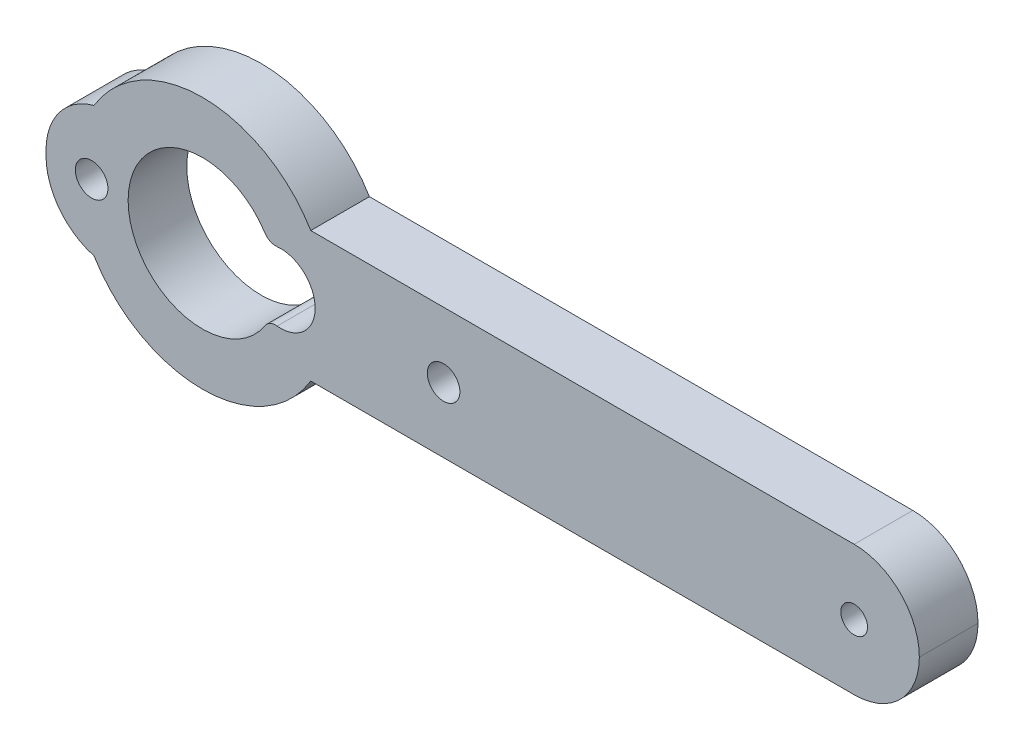
from build123d import *

# Parameters (mm, degrees)
SKETCH_1_R      = 1.025
SKETCH_1_R_2    = 1.25
EXTRUDE_1_DEPTH = 4.5
FILLET_1_R      = 1
FILLET_2_R      = 5
FILLET_3_R      = 5


# Some blends are built 0.0001 mm under size
with BuildPart() as part:
    # 草图1 → 凸台-拉伸1 (new body)
    with BuildSketch(Plane.XY):
        with BuildLine():
            Line((-63.312039461, 0), (-67, 0))
            Line((-67, 0), (-67, -10))
            Line((-67, -10), (-63.312039461, -10))
            ThreePointArc((-63.312039461, -10), (-55, -14.7), (-46.687960539, -10))
            Line((-46.687960539, -10), (0, -10))
            Line((0, -10), (0, 0))
            Line((0, 0), (-46.687960539, 0))
            ThreePointArc((-46.687960539, 0), (-55, 4.7), (-63.312039461, 0))
        make_face()
        with Locations((-5, -5)):
            Circle(SKETCH_1_R, mode=Mode.SUBTRACT)
        with Locations((-63.5, -5)):
            Circle(SKETCH_1_R_2, mode=Mode.SUBTRACT)
        with Locations((-36.5, -5)):
            Circle(SKETCH_1_R_2, mode=Mode.SUBTRACT)
        with BuildLine():
            ThreePointArc((-49.877708333, -2.49957442), (-60.7, -5), (-49.877708333, -7.50042558))
            ThreePointArc((-49.877708333, -7.50042558), (-46.35, -5), (-49.877708333, -2.49957442))
        make_face(mode=Mode.SUBTRACT)
    extrude(amount=EXTRUDE_1_DEPTH)

    # 圆角1
    fillet_1_edges = [part.edges().sort_by_distance(p)[0] for p in [
        (-49.877708333, -7.50042558, 2.25),
        (-49.877708333, -2.49957442, 2.25),
    ]]
    fillet(fillet_1_edges, radius=FILLET_1_R)

    # 圆角2
    fillet_2_edges = [part.edges().sort_by_distance(p)[0] for p in [
        (0, -10, 2.25),
        (0, 0, 2.25),
    ]]
    fillet(fillet_2_edges, radius=FILLET_2_R - 0.0001)  # a hair under: the kernel refuses the full size

    # 圆角3
    # the kernel refuses this fillet: 5 mm, written as the material it takes off along each edge
    with BuildSketch(Plane(origin=(-67, 0, -12.061963059), x_dir=(0, -1, 0), z_dir=(0, 0, 1))) as fillet_3_piece_1:
        with BuildLine():
            CenterArc((4.824785224, 5), FILLET_3_R, 195.212986046, 74.787013954)
            Line((0, 3.687960539), (-0.096495704, 3.66171975))
            ThreePointArc((-0.096495704, 3.66171975), (-0.1, 1.84398027), (-0.1, 0))
            Line((-0.1, 0), (0, -0.1))
            Line((0, -0.1), (4.824785224, -0.1))
            Line((4.824785224, -0.1), (4.824785224, 0))
        make_face()
    extrude(amount=28.623926118, mode=Mode.SUBTRACT)
    with BuildSketch(Plane(origin=(-67, -10, -12.061963059), x_dir=(1, 0, 0), z_dir=(0, 0, 1))) as fillet_3_piece_2:
        with BuildLine():
            CenterArc((5, 4.824785224), FILLET_3_R, 180, 74.787013954)
            Line((0, 4.824785224), (-0.1, 4.824785224))
            Line((-0.1, 4.824785224), (-0.1, 0))
            Line((-0.1, 0), (0, -0.1))
            ThreePointArc((0, -0.1), (1.84398027, -0.1), (3.66171975, -0.096495704))
            Line((3.66171975, -0.096495704), (3.687960539, 0))
        make_face()
    extrude(amount=28.623926118, mode=Mode.SUBTRACT)


solid = part.part
